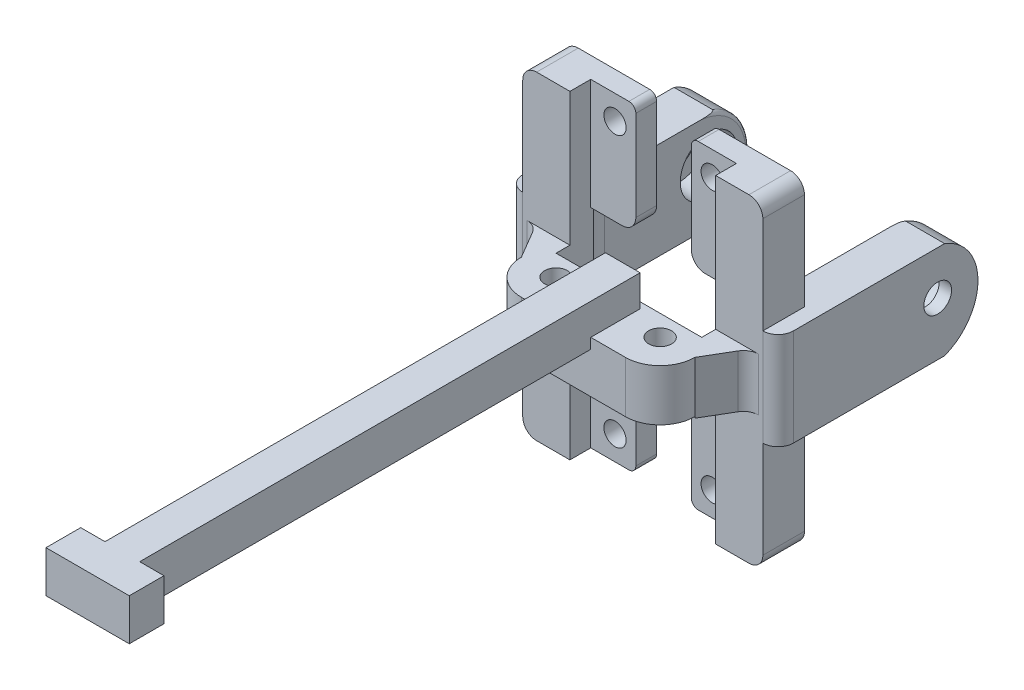
from build123d import *
from OCP.BRepFilletAPI import BRepFilletAPI_MakeFillet

# Parameters (mm, degrees)
EXTRUDE_1_DEPTH           = 7.6
SKETCH_3_R                = 1.65
CUT_EXTRUDE_2_DEPTH       = 25.678475018
SKETCH_5_W                = 30
SKETCH_5_H                = 14
EXTRUDE_3_DEPTH           = 3
CUT_EXTRUDE_7_DEPTH       = 0.2
EXTRUDE_9_DEPTH           = 4.5
EXTRUDE_9_DEPTH_BACK      = 1.5
SKETCH_24_R               = 2
CUT_EXTRUDE_8_DEPTH       = 52.317437946
EXTRUDE_10_DEPTH          = 4.5
EXTRUDE_10_DEPTH_BACK     = 1.5
SKETCH_28_R               = 2
CUT_EXTRUDE_9_DEPTH       = 10
FILLET_1_R                = 5
EXTRUDE_11_DEPTH          = 4.5
FILLET_3_R                = 2.2
EXTRUDE_12_DEPTH          = 1.5
SKETCH_33_R               = 4.1
CUT_EXTRUDE_10_DEPTH      = 4.2
CUT_EXTRUDE_START         = -4.2
SKETCH_35_R               = 4.1
CUT_EXTRUDE_11_DEPTH      = 4.2
SKETCH_36_W               = 21
SKETCH_36_H               = 3.5
CUT_EXTRUDE_12_DEPTH      = 30
EXTRUDE_16_DEPTH          = 16
SKETCH_44_R               = 1.6
CUT_EXTRUDE_15_DEPTH      = 6
FILLET_4_R1               = 2
FILLET_4_R2               = 1
FILLET_5_R                = 2
FILLET_4_OF_MIRROR_1_R1   = 2
FILLET_4_OF_MIRROR_1_R2   = 1
FILLET_5_OF_MIRROR_1_R    = 2
MIRROR_START              = -11
MIRROR_2_DEPTH            = 6
MIRROR_2_2_OUTLINE_R      = 1.6
MIRROR_2_2_DEPTH          = 3
SKETCH_45_W               = 21
SKETCH_45_H               = 2
CUT_EXTRUDE_16_DEPTH      = 85.096611109
CUT_EXTRUDE_17_DEPTH      = 87.210440203
CUT_EXTRUDE_17_DEPTH_BACK = 87.210440203
FILLET_6_R                = 0.5


# Read off the part's stored shape, not the designer's step: 镜向2
with BuildPart() as part:
    # 草图1 → 凸台-拉伸1 (new body)
    with BuildSketch(Plane(origin=(0, 0, 0), x_dir=(1, 0, 0), z_dir=(0, 1, 0))):
        with BuildLine():
            Line((0, 5), (15, 5))
            Line((15, 5), (22.940512837, 5))
            Line((22.940512837, 5), (20, 0))
            ThreePointArc((20, 0), (18.535533906, -3.535533906), (15, -5))
            Line((15, -5), (0, -5))
            ThreePointArc((0, -5), (-3.535533906, -3.535533906), (-5, 0))
            Line((-5, 0), (-7.940512837, 5))
            Line((-7.940512837, 5), (0, 5))
        make_face()
    extrude(amount=EXTRUDE_1_DEPTH)

    # 草图3 → 切除-拉伸2 (cut, through all)
    with BuildSketch(Plane(origin=(0, 7.6, 0), x_dir=(1, 0, 0), z_dir=(0, 1, 0))):
        with Locations(Location((0, 0, 0), (0, 0, 270))):
            Circle(SKETCH_3_R)
        with Locations(Location((15, 0, 0), (0, 0, 270))):
            Circle(SKETCH_3_R)
    extrude(amount=-CUT_EXTRUDE_2_DEPTH, mode=Mode.SUBTRACT)

    # 草图5 → 凸台-拉伸3 (add)
    with BuildSketch(Plane(origin=(0, 0, -5), x_dir=(-1, 0, 0), z_dir=(0, 0, -1))):
        with Locations((-7.5, 3.8)):
            Rectangle(SKETCH_5_W, SKETCH_5_H)
    extrude(amount=EXTRUDE_3_DEPTH)

    # 草图10 → 切除-拉伸7 (cut)
    with BuildSketch(Plane.XZ):
        with BuildLine():
            Line((0, 5), (15, 5))
            ThreePointArc((15, 5), (20, 0), (15, -5))
            Line((15, -5), (0, -5))
            ThreePointArc((0, -5), (-5, 0), (0, 5))
        make_face()
    extrude(amount=-CUT_EXTRUDE_7_DEPTH, mode=Mode.SUBTRACT)

    # 草图21 → 凸台-拉伸9 (add, two sides: drawn at the far end of the back side and taken through both)
    with BuildSketch(Plane(origin=(22.5, 0, 0), x_dir=(0, 0, -1), z_dir=(1, 0, 0)).offset(-EXTRUDE_9_DEPTH_BACK)):
        with BuildLine():
            Line((5, 10.8), (29, 10.8))
            ThreePointArc((29, 10.8), (36, 3.8), (29, -3.2))
            Line((29, -3.2), (5, -3.2))
            Line((5, -3.2), (5, 10.8))
        make_face()
    extrude(amount=EXTRUDE_9_DEPTH + EXTRUDE_9_DEPTH_BACK)

    # 草图24 → 切除-拉伸8 (cut, through all)
    with BuildSketch(Plane(origin=(27, 0, 0), x_dir=(0, 0, -1), z_dir=(1, 0, 0))):
        with Locations((28, 4.5)):
            Circle(SKETCH_24_R)
    extrude(amount=-CUT_EXTRUDE_8_DEPTH, mode=Mode.SUBTRACT)

    # 草图25 → 凸台-拉伸10 (add, two sides: drawn at the far end of the back side and taken through both)
    with BuildSketch(Plane.ZY.offset(7.5).offset(-EXTRUDE_10_DEPTH_BACK)):
        with BuildLine():
            Line((-5, -3.2), (-29, -3.2))
            ThreePointArc((-29, -3.2), (-36, 3.8), (-29, 10.8))
            Line((-29, 10.8), (-5, 10.8))
            Line((-5, 10.8), (-5, -3.2))
        make_face()
    extrude(amount=EXTRUDE_10_DEPTH + EXTRUDE_10_DEPTH_BACK)

    # 草图28 → 切除-拉伸9 (cut)
    with BuildSketch(Plane(origin=(-6, 0, 0), x_dir=(0, 0, -1), z_dir=(1, 0, 0))):
        with Locations((28, 4.5)):
            Circle(SKETCH_28_R)
    extrude(amount=-CUT_EXTRUDE_9_DEPTH, mode=Mode.SUBTRACT)

    # 圆角1
    fillet_1_edges = [part.edges().sort_by_distance(p)[0] for p in [
        (-6, 3.8, -8),
        (21, 3.8, -8),
    ]]
    fillet(fillet_1_edges, radius=FILLET_1_R)

    # 草图30 → 凸台-拉伸11 (add)
    with BuildSketch(Plane(origin=(0, 7.6, 0), x_dir=(1, 0, 0), z_dir=(0, 1, 0))):
        Polygon((10, -70), (13.5, -70), (13.5, -75), (1.5, -75), (1.5, -70), (5, -70), (5, 2.116473595), (10, 2.116473595), align=None)
    extrude(amount=EXTRUDE_11_DEPTH)

    # 圆角3
    fillet_3_edges = [part.edges().sort_by_distance(p)[0] for p in [
        (-12, 3.8, -5),
        (-7.940512837, 3.8, -5),
        (22.940512837, 3.8, -5),
        (27, 3.8, -5),
    ]]
    fillet(fillet_3_edges, radius=FILLET_3_R)

    # 草图31 → 凸台-拉伸12 (add)
    with BuildSketch(Plane.XZ.offset(-7.6)):
        Polygon((5, 70), (5, 5), (10, 5), (10, 70), (13.5, 70), (13.5, 75), (1.5, 75), (1.5, 70), align=None)
    extrude(amount=EXTRUDE_12_DEPTH)

    # 草图33 → 切除-拉伸10 (cut)
    with BuildSketch(Plane.ZY.offset(-21)):
        with Locations((-28, 4.5)):
            Circle(SKETCH_33_R)
    extrude(amount=-CUT_EXTRUDE_10_DEPTH, mode=Mode.SUBTRACT)

    # 草图35 → 切除-拉伸11 (cut)
    with BuildSketch(Plane(origin=(-6, 0, 0), x_dir=(0, 0, -1), z_dir=(1, 0, 0)).offset(CUT_EXTRUDE_START)):
        with Locations(Location((28, 4.5, 0), (0, 0, 180))):
            Circle(SKETCH_35_R)
    extrude(amount=CUT_EXTRUDE_11_DEPTH, mode=Mode.SUBTRACT)

    # 草图36 → 切除-拉伸12 (cut)
    with BuildSketch(Plane(origin=(0, 10.8, 0), x_dir=(1, 0, 0), z_dir=(0, 1, 0))):
        with Locations((7.5, 6.75)):
            Rectangle(SKETCH_36_W, SKETCH_36_H)
    extrude(amount=-CUT_EXTRUDE_12_DEPTH, mode=Mode.SUBTRACT)

    # 草图41 → 凸台-拉伸16 (add)
    with BuildSketch(Plane(origin=(0, 10.8, 0), x_dir=(1, 0, 0), z_dir=(0, 1, 0))):
        Polygon((17.5, 11), (11.5, 11), (11.5, 8), (18, 8), (18, 5), (24.8, 5), (24.8, 11), align=None)
    extrude_16 = extrude(amount=EXTRUDE_16_DEPTH)

    # 草图44 → 切除-拉伸15 (cut)
    with BuildSketch(Plane(origin=(0, 0, -11), x_dir=(-1, 0, 0), z_dir=(0, 0, -1))):
        with Locations((-14.5, 23.3)):
            Circle(SKETCH_44_R)
    cut_extrude_15 = extrude(amount=-CUT_EXTRUDE_15_DEPTH, mode=Mode.SUBTRACT)

    # 圆角4: one fillet with a radius per group of edges: ONE call of the kernel's fillet builder (fillet() takes one radius for all edges)
    fillet_4_edges_1 = [part.edges().sort_by_distance(p)[0] for p in [
        (11.5, 10.8, -9.5),
    ]]
    fillet_4_edges_2 = [part.edges().sort_by_distance(p)[0] for p in [
        (11.5, 26.8, -9.5),
    ]]
    fillet_4 = BRepFilletAPI_MakeFillet(part.part.solid().wrapped)
    for e in fillet_4_edges_1:
        fillet_4.Add(FILLET_4_R1, e.wrapped)
    for e in fillet_4_edges_2:
        fillet_4.Add(FILLET_4_R2, e.wrapped)
    add(Compound.cast(fillet_4.Shape()), mode=Mode.REPLACE)

    # 圆角5
    fillet_5_edges = [part.edges().sort_by_distance(p)[0] for p in [
        (24.8, 26.8, -8),
    ]]
    fillet(fillet_5_edges, radius=FILLET_5_R)

    # 镜向1: 凸台-拉伸16, 切除-拉伸15 across plane
    add(extrude_16.mirror(Plane(origin=(7.5, 0, 0), x_dir=(0, 0, 1), z_dir=(1, 0, 0))))
    add(cut_extrude_15.mirror(Plane(origin=(7.5, 0, 0), x_dir=(0, 0, 1), z_dir=(1, 0, 0))), mode=Mode.SUBTRACT)

    # 圆角4 of 镜向1: one fillet with a radius per group of edges: ONE call of the kernel's fillet builder (fillet() takes one radius for all edges)
    fillet_4_of_mirror_1_edges_1 = [part.edges().sort_by_distance(p)[0] for p in [
        (3.5, 10.8, -9.5),
    ]]
    fillet_4_of_mirror_1_edges_2 = [part.edges().sort_by_distance(p)[0] for p in [
        (3.5, 26.8, -9.5),
    ]]
    fillet_4_of_mirror_1 = BRepFilletAPI_MakeFillet(part.part.solid().wrapped)
    for e in fillet_4_of_mirror_1_edges_1:
        fillet_4_of_mirror_1.Add(FILLET_4_OF_MIRROR_1_R1, e.wrapped)
    for e in fillet_4_of_mirror_1_edges_2:
        fillet_4_of_mirror_1.Add(FILLET_4_OF_MIRROR_1_R2, e.wrapped)
    add(Compound.cast(fillet_4_of_mirror_1.Shape()), mode=Mode.REPLACE)

    # 圆角5 of 镜向1
    fillet_5_of_mirror_1_edges = [part.edges().sort_by_distance(p)[0] for p in [
        (-9.8, 26.8, -8),
    ]]
    fillet(fillet_5_of_mirror_1_edges, radius=FILLET_5_OF_MIRROR_1_R)

    # 镜向2 outline → 镜向2 (add)
    with BuildSketch(Plane.XY.offset(MIRROR_START)):
        with BuildLine():
            Line((18, -3.2), (18, -19.2))
            Line((18, -19.2), (22.8, -19.2))
            ThreePointArc((22.8, -19.2), (24.214213562, -18.614213562), (24.8, -17.2))
            Line((24.8, -17.2), (24.8, -3.2))
            Line((24.8, -3.2), (18, -3.2))
        make_face()
        with BuildLine():
            Line((-3, -19.2), (-3, -3.2))
            Line((-3, -3.2), (-9.8, -3.2))
            Line((-9.8, -3.2), (-9.8, -17.2))
            ThreePointArc((-9.8, -17.2), (-9.214213562, -18.614213562), (-7.8, -19.2))
            Line((-7.8, -19.2), (-3, -19.2))
        make_face()
    extrude(amount=MIRROR_2_DEPTH)

    # Mirror 2 2 outline → Mirror 2 2 (add)
    # profile 1 of 2: a face of its own
    with BuildSketch(Plane.XY.offset(MIRROR_START)):
        with BuildLine():
            Line((12.5, -19.2), (18, -19.2))
            Line((18, -19.2), (18, -3.2))
            Line((18, -3.2), (13.5, -3.2))
            ThreePointArc((13.5, -3.2), (12.085786438, -3.785786438), (11.5, -5.2))
            Line((11.5, -5.2), (11.5, -18.2))
            ThreePointArc((11.5, -18.2), (11.792893219, -18.907106781), (12.5, -19.2))
        make_face()
        with Locations((14.5, -15.7)):
            Circle(MIRROR_2_2_OUTLINE_R, mode=Mode.SUBTRACT)
    # profile 2 of 2: a face of its own
    with BuildSketch(Plane.XY.offset(MIRROR_START)):
        with BuildLine():
            Line((1.5, -3.2), (-3, -3.2))
            Line((-3, -3.2), (-3, -19.2))
            Line((-3, -19.2), (2.5, -19.2))
            ThreePointArc((2.5, -19.2), (3.207106781, -18.907106781), (3.5, -18.2))
            Line((3.5, -18.2), (3.5, -5.2))
            ThreePointArc((3.5, -5.2), (2.914213562, -3.785786438), (1.5, -3.2))
        make_face()
        with Locations((0.5, -15.7)):
            Circle(MIRROR_2_2_OUTLINE_R, mode=Mode.SUBTRACT)
    extrude(amount=MIRROR_2_2_DEPTH)

    # 草图45 → 切除-拉伸16 (cut, through all)
    with BuildSketch(Plane(origin=(0, 7.6, 0), x_dir=(1, 0, 0), z_dir=(0, 1, 0))):
        with Locations((7.5, 4)):
            Rectangle(SKETCH_45_W, SKETCH_45_H)
    extrude(amount=-CUT_EXTRUDE_16_DEPTH, mode=Mode.SUBTRACT)

    # 草图46 → 切除-拉伸17 (cut, two sides: drawn at the far end of the back side and taken through both)
    with BuildSketch(Plane.ZY.offset(-21).offset(-CUT_EXTRUDE_17_DEPTH_BACK)):
        with BuildLine():
            ThreePointArc((-29, 10.8), (-33.807417596, 3.8), (-29, -3.2))
            ThreePointArc((-29, -3.2), (-36, 3.8), (-29, 10.8))
        make_face()
    extrude(amount=CUT_EXTRUDE_17_DEPTH + CUT_EXTRUDE_17_DEPTH_BACK, mode=Mode.SUBTRACT)

    # 圆角6
    fillet_6_edges = [part.edges().sort_by_distance(p)[0] for p in [
        (21, 3.8, -33.807417596),
        (-6, 3.8, -33.807417596),
    ]]
    fillet(fillet_6_edges, radius=FILLET_6_R - 0.0001)  # a hair under: the kernel refuses the full size


solid = part.part
